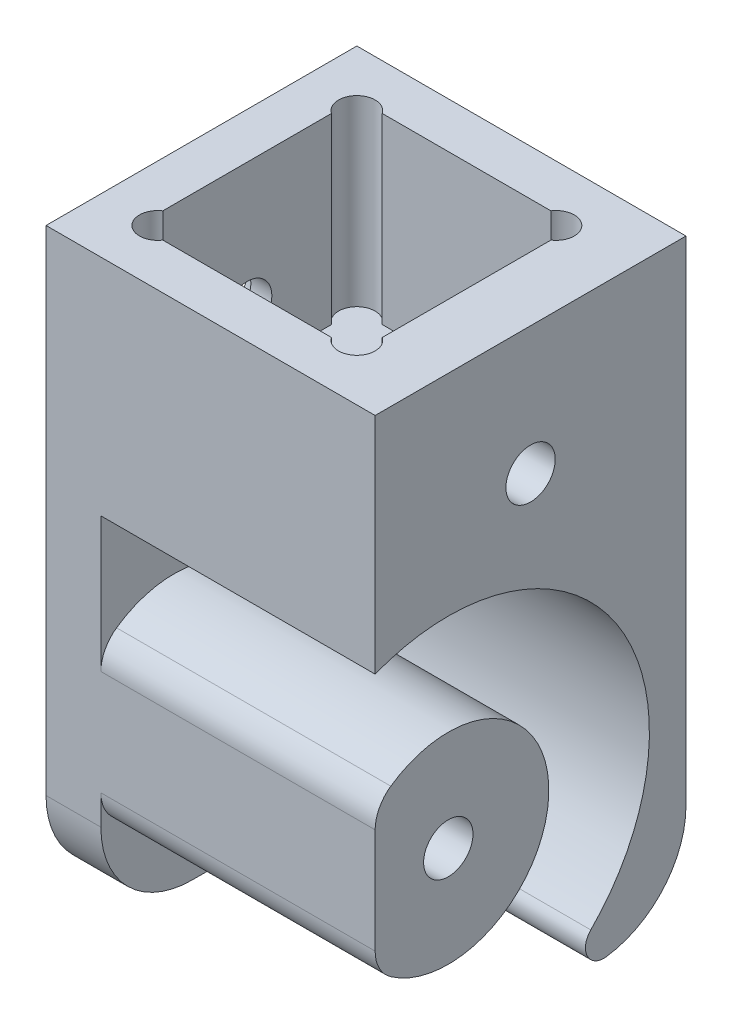
from build123d import *

# Parameters (mm, degrees)
SKETCH_1_W                = 18
SKETCH_1_H                = 17
SKETCH_1_W_2              = 12
SKETCH_1_H_2              = 12
EXTRUDE_1_DEPTH           = 10
SKETCH_4_W                = 18
SKETCH_4_H                = 17
EXTRUDE_2_DEPTH           = 22
SKETCH_5_R                = 11
CUT_EXTRUDE_1_DEPTH       = 15
SKETCH_8_R                = 1.25
EXTRUDE_3_DEPTH           = 15
SKETCH_13_R               = 1.25
CUT_EXTRUDE_5_DEPTH       = 30.669007398
SKETCH_9_R                = 1.35
CUT_EXTRUDE_3_DEPTH       = 30.669007398
FILLET_4_R                = 5
SKETCH_20_R               = 1
CUT_EXTRUDE_7_DEPTH       = 10
FILLET_5_R                = 5
FILLET_6_R                = 2
FILLET_7_R                = 1
HOLE_WIZARD_1_D           = 2.7
HOLE_WIZARD_1_CSINK_D     = 5.4
HOLE_WIZARD_1_CSINK_ANGLE = 90


with BuildPart() as part:
    # 草图1 → 凸台-拉伸1 (new body)
    with BuildSketch(Plane(origin=(0, 0, 0), x_dir=(1, 0, 0), z_dir=(0, 1, 0))):
        Rectangle(SKETCH_1_W, SKETCH_1_H)
        with Locations((-0.5, 0)):
            Rectangle(SKETCH_1_W_2, SKETCH_1_H_2, mode=Mode.SUBTRACT)
    extrude(amount=EXTRUDE_1_DEPTH)

    # 草图4 → 凸台-拉伸2 (add)
    with BuildSketch(Plane.XZ):
        Rectangle(SKETCH_4_W, SKETCH_4_H)
    extrude(amount=EXTRUDE_2_DEPTH)

    # 草图5 → 切除-拉伸1 (cut)
    with BuildSketch(Plane.ZY.offset(-9)):
        with Locations((4.5, -12.5)):
            Circle(SKETCH_5_R)
    extrude(amount=CUT_EXTRUDE_1_DEPTH, mode=Mode.SUBTRACT)

    # 草图8 → 凸台-拉伸3 (add)
    with BuildSketch(Plane(origin=(-6, 0, 0), x_dir=(0, 0, -1), z_dir=(1, 0, 0))):
        with BuildLine():
            Line((-8.5, -8.725082782), (-8.5, -16.274917218))
            ThreePointArc((-8.5, -16.274917218), (1, -12.5), (-8.5, -8.725082782))
        make_face()
        with Locations(Location((-4.5, -12.5, 0), (0, 0, 180))):
            Circle(SKETCH_8_R, mode=Mode.SUBTRACT)
    extrude(amount=EXTRUDE_3_DEPTH)

    # 草图13 → 切除-拉伸5 (cut, through all)
    with BuildSketch(Plane(origin=(9, 0, 0), x_dir=(0, 0, -1), z_dir=(1, 0, 0))):
        with Locations((0, 3)):
            Circle(SKETCH_13_R)
    extrude(amount=-CUT_EXTRUDE_5_DEPTH, mode=Mode.SUBTRACT)

    # 草图9 → 切除-拉伸3 (cut, through all)
    with BuildSketch(Plane(origin=(9, 0, 0), x_dir=(0, 0, -1), z_dir=(1, 0, 0))):
        with Locations((-4.5, -12.5)):
            Circle(SKETCH_9_R)
    extrude(amount=-CUT_EXTRUDE_3_DEPTH, mode=Mode.SUBTRACT)

    # 圆角4
    fillet_4_edges = [part.edges().sort_by_distance(p)[0] for p in [
        (0, -22, -8.5),
    ]]
    fillet(fillet_4_edges, radius=FILLET_4_R)

    # 草图20 → 切除-拉伸7 (cut)
    with BuildSketch(Plane(origin=(0, 10, 0), x_dir=(1, 0, 0), z_dir=(0, 1, 0))):
        with Locations((4.944722215, -5.444722215)):
            Circle(SKETCH_20_R)
        with Locations((4.944722215, 5.444722215)):
            Circle(SKETCH_20_R)
        with Locations((-5.944722215, 5.444722215)):
            Circle(SKETCH_20_R)
        with Locations((-5.944722215, -5.444722215)):
            Circle(SKETCH_20_R)
    extrude(amount=-CUT_EXTRUDE_7_DEPTH, mode=Mode.SUBTRACT)

    # 圆角5
    fillet_5_edges = [part.edges().sort_by_distance(p)[0] for p in [
        (-7.5, -22, 8.5),
    ]]
    fillet(fillet_5_edges, radius=FILLET_5_R)

    # 圆角6
    fillet_6_edges = [part.edges().sort_by_distance(p)[0] for p in [
        (1.5, -16.274917218, 8.5),
        (1.5, -8.725082782, 8.5),
    ]]
    fillet(fillet_6_edges, radius=FILLET_6_R)

    # 圆角7
    # the kernel refuses this fillet: 1 mm, written as the material it takes off along each edge
    with BuildSketch(Plane(origin=(-6, -22, -1.045268253), x_dir=(0, 0.6114361728106764, -0.7912937549220469), z_dir=(1, 0, 0))) as fillet_7_piece_1:
        with BuildLine():
            CenterArc((2.970570235, -0.991624388), FILLET_7_R, 97.420778889, 142.097986779)
            Line((2.463314102, -1.853419733), (2.412588489, -1.939599267))
            ThreePointArc((2.412588489, -1.939599267), (1.881270284, -1.58004116), (-0.061143617, -0.079129375))
            Line((-0.061143617, -0.079129375), (0.012915523, 0.099162439))
            ThreePointArc((0.012915523, 0.099162439), (1.420707504, 0.00786827), (2.828499484, 0.099162439))
            Line((2.828499484, 0.099162439), (2.841415007, 0))
        make_face()
    extrude(amount=22.706766942, mode=Mode.SUBTRACT)

    # 打孔尺寸(%根据十字)槽沉头木螺钉的类型1 (through all)
    with Locations(Plane.ZY.offset(9)):
        with Locations((4.5, -12.5), (0, 3)):
            CounterSinkHole(HOLE_WIZARD_1_D / 2, HOLE_WIZARD_1_CSINK_D / 2, counter_sink_angle=HOLE_WIZARD_1_CSINK_ANGLE)


solid = part.part
